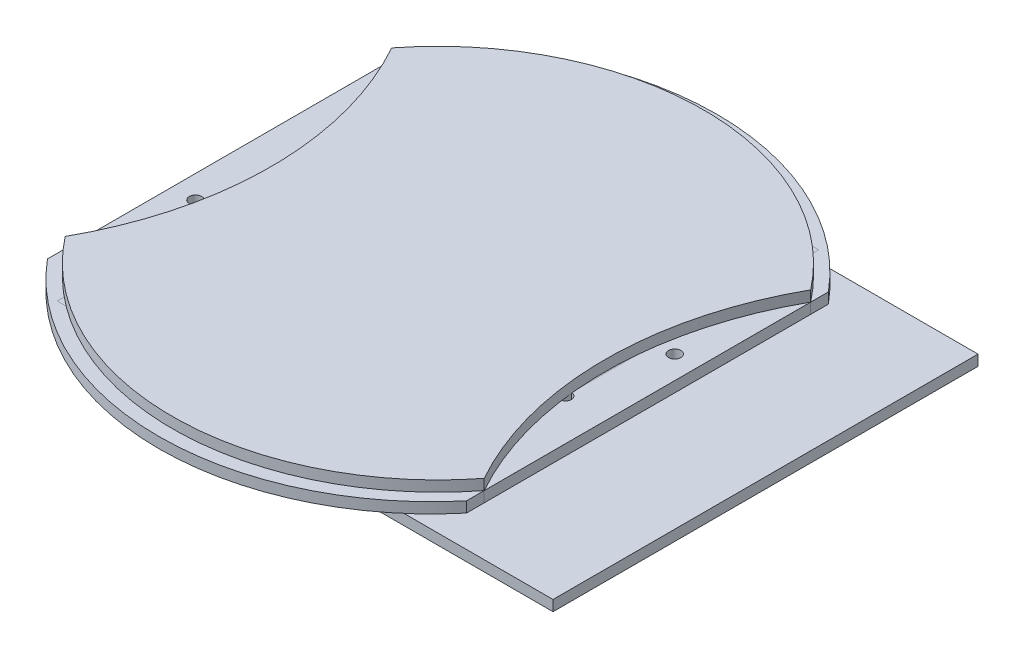
from build123d import *

# Parameters (mm, degrees)
SKETCH1_W                      = 140
SKETCH1_H                      = 120
COMPACT_DEPTH                  = 3
SKETCH4_W                      = 95
SKETCH4_H                      = 120
SUPERCOMPACT_DEPTH             = 3
SKETCH7_R                      = 75
APPLE_BASE_DEPTH               = 3
SIDECUTS_DEPTH                 = 195.694632694
APPLE_BASE_2_DEPTH             = 3
BOSS_EXTRUDE4_DEPTH            = 3
BASE_PLATE_FILLET_R            = 0.001
SKETCH19_W                     = 100
SKETCH19_H                     = 28
LINESENSOR_GUIDE_DEPTH         = 0.1
LINESENSOR_START               = -0.1
LINESENSOR_HOLES_OUTLINE_R     = 1.710996593
LINESENSOR_HOLES_OUTLINE_W     = 7
LINESENSOR_HOLES_OUTLINE_H     = 10
LINESENSOR_HOLES_OUTLINE_W_2   = 12
LINESENSOR_HOLES_OUTLINE_H_2   = 12
LINESENSOR_HOLES_DEPTH         = 0.1
LINESENSOR_START_2             = -3.1
LINESENSOR_HOLES_2_OUTLINE_R   = 1.710996593
LINESENSOR_HOLES_2_OUTLINE_W   = 7
LINESENSOR_HOLES_2_OUTLINE_H   = 10
LINESENSOR_HOLES_2_OUTLINE_W_2 = 12
LINESENSOR_HOLES_2_OUTLINE_H_2 = 12
LINESENSOR_HOLES_2_DEPTH       = 3
TOP_BOTTOM_EXTENSIONS_DEPTH    = 3
SKETCH26_R                     = 1.75
GEARBOX_HOLES_DEPTH            = 11
SKETCH32_R                     = 1.5
CASTOR_WHEEL_HOLES_DEPTH       = 10
SKETCH35_R                     = 1.25
SPACERHOLES_DEPTH              = 10


# Read off the part's stored shape, not the designer's step: LineSensor holes
with BuildPart() as part:
    # Sketch1 → Compact (new body)
    with BuildSketch(Plane(origin=(0, 0, 0), x_dir=(1, 0, 0), z_dir=(0, 1, 0))):
        with Locations((70, 60)):
            Rectangle(SKETCH1_W, SKETCH1_H)
    extrude(amount=COMPACT_DEPTH)


with BuildPart() as body_2:
    # Sketch4 → SuperCompact (new body)
    with BuildSketch(Plane(origin=(0, 3, 0), x_dir=(1, 0, 0), z_dir=(0, 1, 0))):
        with Locations((47.5, 60)):
            Rectangle(SKETCH4_W, SKETCH4_H)
    extrude(amount=SUPERCOMPACT_DEPTH)


with BuildPart() as body_3:
    # Sketch7 → Apple Base (new body)
    with BuildSketch(Plane(origin=(0, 6, 0), x_dir=(1, 0, 0), z_dir=(0, 1, 0))):
        with Locations(Location((47.5, 60, 0), (0, 0, 270))):
            Circle(SKETCH7_R)
    extrude(amount=APPLE_BASE_DEPTH)

    # Sketch8 → SideCuts (cut, through all)
    with BuildSketch(Plane(origin=(0, 9, 0), x_dir=(1, 0, 0), z_dir=(0, 1, 0))):
        with BuildLine():
            ThreePointArc((-11.66, 106.098746187), (0.350007958, 60), (-11.66, 13.901253813))
            ThreePointArc((-11.66, 13.901253813), (-27.5, 60), (-11.66, 106.098746187))
        make_face()
        with BuildLine():
            ThreePointArc((106.66, 106.098746187), (94.649992042, 60), (106.66, 13.901253813))
            ThreePointArc((106.66, 13.901253813), (122.5, 60), (106.66, 106.098746187))
        make_face()
    extrude(amount=-SIDECUTS_DEPTH, mode=Mode.SUBTRACT)


with BuildPart() as body_4:
    # Sketch9 → Apple_Base 2 (new body)
    with BuildSketch(Plane.XZ.offset(-6)):
        with BuildLine():
            ThreePointArc((106.66, -13.901253813), (47.5, 15), (-11.66, -13.901253813))
            ThreePointArc((-11.66, -13.901253813), (0.350007958, -60), (-11.66, -106.098746187))
            ThreePointArc((-11.66, -106.098746187), (47.5, -135), (106.66, -106.098746187))
            ThreePointArc((106.66, -106.098746187), (94.649992042, -60), (106.66, -13.901253813))
        make_face()
    extrude(amount=APPLE_BASE_2_DEPTH)

    # Sketch10 → Boss-Extrude4 (add)
    with BuildSketch(Plane(origin=(0, 6, 0), x_dir=(1, 0, 0), z_dir=(0, 1, 0))):
        with BuildLine():
            Line((-11.66, 106.098746187), (-11.66, 13.901253813))
            ThreePointArc((-11.66, 13.901253813), (0.350007958, 60), (-11.66, 106.098746187))
        make_face()
        with BuildLine():
            Line((106.66, 106.098746187), (106.66, 13.901253813))
            ThreePointArc((106.66, 13.901253813), (94.649992042, 60), (106.66, 106.098746187))
        make_face()
    extrude(amount=-BOSS_EXTRUDE4_DEPTH)

    # Base_Plate_Fillet
    base_plate_fillet_edges = [body_4.edges().sort_by_distance(p)[0] for p in [
        (-11.66, 3, -60),
        (-11.66, 6, -60),
        (47.5, 3, -135),
        (106.66, 3, -60),
        (106.66, 6, -60),
        (47.5, 6, -135),
        (47.5, 6, 15),
        (106.66, 4.5, -106.098746187),
        (-11.66, 4.5, -106.098746187),
        (-11.66, 4.5, -13.901253813),
        (106.66, 4.5, -13.901253813),
        (47.5, 3, 15),
    ]]
    fillet(base_plate_fillet_edges, radius=BASE_PLATE_FILLET_R)

    # LineSensor holes 2 outline → LineSensor holes 2 (cut)
    with BuildSketch(Plane.XZ.offset(-2.9).offset(LINESENSOR_START_2)):
        with Locations((37.5, -48.5)):
            Circle(LINESENSOR_HOLES_2_OUTLINE_R)
        with Locations((95, -48.5)):
            Circle(LINESENSOR_HOLES_2_OUTLINE_R)
        with Locations((57.5, -48.5)):
            Circle(LINESENSOR_HOLES_2_OUTLINE_R)
        with Locations((47.5, -48.5)):
            Circle(LINESENSOR_HOLES_2_OUTLINE_R)
        with Locations((0, -48.5)):
            Circle(LINESENSOR_HOLES_2_OUTLINE_R)
        with Locations((90, -57.5)):
            Rectangle(LINESENSOR_HOLES_2_OUTLINE_W, LINESENSOR_HOLES_2_OUTLINE_H)
        with Locations((14.5, -60.5)):
            Rectangle(LINESENSOR_HOLES_2_OUTLINE_W_2, LINESENSOR_HOLES_2_OUTLINE_H_2)
    extrude(amount=LINESENSOR_HOLES_2_DEPTH, mode=Mode.SUBTRACT)

    # Sketch25 → Top Bottom extensions (add)
    with BuildSketch(Plane(origin=(0, 6, 0), x_dir=(1, 0, 0), z_dir=(0, 1, 0))):
        with BuildLine():
            Line((-11.659005821, 106.097402592), (-11.659005821, 111.097402592))
            ThreePointArc((-11.659005821, 111.097402592), (47.5, 138.794628322), (106.659005821, 111.097402592))
            Line((106.659005821, 111.097402592), (106.659005821, 106.097402592))
            ThreePointArc((106.659005821, 106.097402592), (47.5, 133.794628322), (-11.659005821, 106.097402592))
        make_face()
        with BuildLine():
            Line((106.659005821, 13.902597408), (106.659005821, 8.902597408))
            ThreePointArc((106.659005821, 8.902597408), (47.5, -18.794628322), (-11.659005821, 8.902597408))
            Line((-11.659005821, 8.902597408), (-11.659005821, 13.902597408))
            ThreePointArc((-11.659005821, 13.902597408), (47.5, -13.794628322), (106.659005821, 13.902597408))
        make_face()
    extrude(amount=-TOP_BOTTOM_EXTENSIONS_DEPTH)

    # Sketch26 → GearBox holes (cut)
    with BuildSketch(Plane(origin=(0, 6, 0), x_dir=(1, 0, 0), z_dir=(0, 1, 0))):
        with Locations(Location((-5.159, 44.202592592, 0), (0, 0, 270))):
            Circle(SKETCH26_R)
        with Locations(Location((-5.159, 105.002592592, 0), (0, 0, 270))):
            Circle(SKETCH26_R)
        with Locations(Location((100.159, 74.197402592, 0), (0, 0, 270))):
            Circle(SKETCH26_R)
        with Locations(Location((100.159, 13.397402592, 0), (0, 0, 270))):
            Circle(SKETCH26_R)
    extrude(amount=-GEARBOX_HOLES_DEPTH, mode=Mode.SUBTRACT)

    # Sketch32 → Castor Wheel Holes (cut)
    with BuildSketch(Plane(origin=(0, 6, 0), x_dir=(1, 0, 0), z_dir=(0, 1, 0))):
        with Locations(Location((47.5, 132.294628322, 0), (0, 0, 270))):
            Circle(SKETCH32_R)
        with Locations(Location((56.59326674, 116.544628322, 0), (0, 0, 270))):
            Circle(SKETCH32_R)
        with Locations(Location((38.40673326, 116.544628322, 0), (0, 0, 270))):
            Circle(SKETCH32_R)
        with Locations(Location((47.5, -12.294628322, 0), (0, 0, 90))):
            Circle(SKETCH32_R)
        with Locations(Location((56.59326674, 3.455371678, 0), (0, 0, 90))):
            Circle(SKETCH32_R)
        with Locations(Location((38.40673326, 3.455371678, 0), (0, 0, 90))):
            Circle(SKETCH32_R)
    extrude(amount=-CASTOR_WHEEL_HOLES_DEPTH, mode=Mode.SUBTRACT)

    # Sketch35 → SpacerHoles (cut)
    with BuildSketch(Plane.XZ.offset(-3)):
        with Locations(Location((7.5, -4.4, 0), (0, 0, 270))):
            Circle(SKETCH35_R)
        with Locations(Location((87.5, -4.4, 0), (0, 0, 270))):
            Circle(SKETCH35_R)
        with Locations(Location((87.5, -115.6, 0), (0, 0, 270))):
            Circle(SKETCH35_R)
        with Locations(Location((7.5, -115.6, 0), (0, 0, 270))):
            Circle(SKETCH35_R)
    extrude(amount=-SPACERHOLES_DEPTH, mode=Mode.SUBTRACT)


with BuildPart() as body_5:
    # Sketch19 → LineSensor Guide (new body)
    with BuildSketch(Plane.XZ.offset(-3)):
        with Locations((47.5, -60)):
            Rectangle(SKETCH19_W, SKETCH19_H)
    extrude(amount=LINESENSOR_GUIDE_DEPTH)

    # LineSensor holes outline → LineSensor holes (cut)
    with BuildSketch(Plane.XZ.offset(-2.9).offset(LINESENSOR_START)):
        with Locations((37.5, -48.5)):
            Circle(LINESENSOR_HOLES_OUTLINE_R)
        with Locations((95, -48.5)):
            Circle(LINESENSOR_HOLES_OUTLINE_R)
        with Locations((57.5, -48.5)):
            Circle(LINESENSOR_HOLES_OUTLINE_R)
        with Locations((47.5, -48.5)):
            Circle(LINESENSOR_HOLES_OUTLINE_R)
        with Locations((0, -48.5)):
            Circle(LINESENSOR_HOLES_OUTLINE_R)
        with Locations((90, -57.5)):
            Rectangle(LINESENSOR_HOLES_OUTLINE_W, LINESENSOR_HOLES_OUTLINE_H)
        with Locations((14.5, -60.5)):
            Rectangle(LINESENSOR_HOLES_OUTLINE_W_2, LINESENSOR_HOLES_OUTLINE_H_2)
    extrude(amount=LINESENSOR_HOLES_DEPTH, mode=Mode.SUBTRACT)


solid = Compound([part.part, body_2.part, body_3.part, body_4.part, body_5.part])
